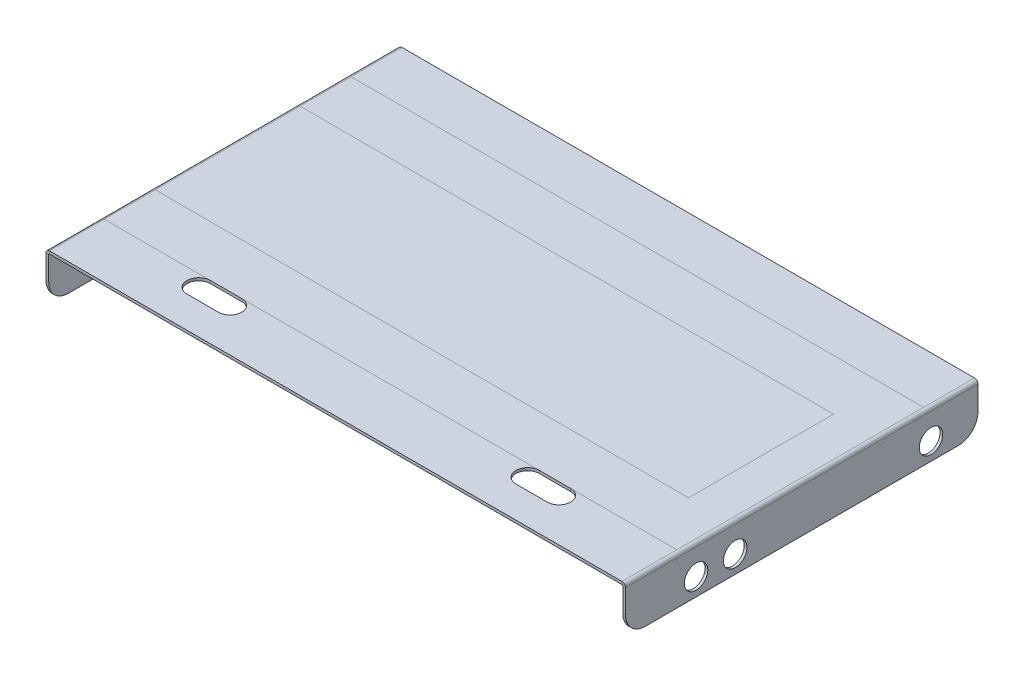
from build123d import *

# Parameters (mm, degrees)
SKETCH_1_W                         = 148
SKETCH_1_H                         = 90
SM_BASE_FLANGE_1_DEPTH             = 0.7
SM_EDGE_FLANGE_1_STRIP_W           = 3.2
SM_EDGE_FLANGE_1_STRIP_H           = 0.7
SM_EDGE_FLANGE_1_STRIP_CUT_DEPTH   = 90
SM_EDGE_FLANGE_1_STRIP_2_W         = 3.2
SM_EDGE_FLANGE_1_STRIP_2_H         = 0.7
SM_EDGE_FLANGE_1_STRIP_CUT_2_DEPTH = 90
SM_EDGE_FLANGE_1_DEPTH             = 90
SM_EDGE_FLANGE_1_PROFILE_W         = 90
SM_EDGE_FLANGE_1_PROFILE_H         = 11.1
SM_EDGE_FLANGE_1_PROFILE_R         = 3
SM_EDGE_FLANGE_1_FLAT_DEPTH        = 0.7
SM_EDGE_FLANGE_1_BEND_DEPTH        = 90
FILLET_2_R                         = 5
CUT_EXTRUDE_START                  = -10
SKETCH_15_R                        = 3
CUT_EXTRUDE_1_DEPTH                = 10
SPLIT_BODIES_1_SURFACE_1_BACK      = 174.632
SPLIT_BODIES_1_SURFACE_1_DEPTH     = 349.264
SPLIT_BODIES_1_SURFACE_2_BACK      = 174.632
SPLIT_BODIES_1_SURFACE_2_DEPTH     = 349.264


# Sheet-metal steps are written as plain solids
with BuildPart() as part:
    # Sketch 1 → 基体-法兰1 (new body)
    with BuildSketch(Plane(origin=(0, 0, 0), x_dir=(1, 0, 0), z_dir=(0, 1, 0))):
        Rectangle(SKETCH_1_W, SKETCH_1_H)
        with BuildLine():
            Line((-46, -31), (-38, -31))
            ThreePointArc((-38, -31), (-35, -34), (-38, -37))
            Line((-38, -37), (-46, -37))
            ThreePointArc((-46, -37), (-49, -34), (-46, -31))
        make_face(mode=Mode.SUBTRACT)
        with BuildLine():
            Line((38, -31), (46, -31))
            ThreePointArc((46, -31), (49, -34), (46, -37))
            Line((46, -37), (38, -37))
            ThreePointArc((38, -37), (35, -34), (38, -31))
        make_face(mode=Mode.SUBTRACT)
    extrude(amount=-SM_BASE_FLANGE_1_DEPTH)

    # 边线-法兰1 strip (across the edge) → 边线-法兰1 strip cut (cut)
    with BuildSketch(Plane(origin=(74, -0.7, -45), x_dir=(-1, 0, 0), z_dir=(0, 0, 1))):
        with Locations((-0.7, -0.35)):
            Rectangle(SM_EDGE_FLANGE_1_STRIP_W, SM_EDGE_FLANGE_1_STRIP_H)
    extrude(amount=SM_EDGE_FLANGE_1_STRIP_CUT_DEPTH, mode=Mode.SUBTRACT)

    # 边线-法兰1 strip 2 (across the edge) → 边线-法兰1 strip cut 2 (cut)
    with BuildSketch(Plane(origin=(-74, -0.7, 45), x_dir=(1, 0, 0), z_dir=(0, 0, -1))):
        with Locations((-0.7, -0.35)):
            Rectangle(SM_EDGE_FLANGE_1_STRIP_2_W, SM_EDGE_FLANGE_1_STRIP_2_H)
    extrude(amount=SM_EDGE_FLANGE_1_STRIP_CUT_2_DEPTH, mode=Mode.SUBTRACT)

    # 边线-法兰1 bend section (across the edge) → 边线-法兰1 (add)
    with BuildSketch(Plane(origin=(74, -0.7, -45), x_dir=(-1, 0, 0), z_dir=(0, 0, 1))):
        with BuildLine():
            Line((0, 0.2), (0.7, 0.2))
            ThreePointArc((0.7, 0.2), (0.758578644, 0.058578644), (0.9, 0))
            Line((0.9, 0), (0.9, -0.7))
            ThreePointArc((0.9, -0.7), (0.263603897, -0.436396103), (0, 0.2))
        make_face()
    extrude(amount=SM_EDGE_FLANGE_1_DEPTH)

    # 边线-法兰1 profile (on flange) → 边线-法兰1 flat (add)
    with BuildSketch(Plane(origin=(74, -0.7, 0), x_dir=(0, 0, 1), z_dir=(1, 0, 0))):
        with Locations((0, 5.75)):
            Rectangle(SM_EDGE_FLANGE_1_PROFILE_W, SM_EDGE_FLANGE_1_PROFILE_H)
        with Locations((17, 6.8)):
            Circle(SM_EDGE_FLANGE_1_PROFILE_R, mode=Mode.SUBTRACT)
        with Locations((27, 6.8)):
            Circle(SM_EDGE_FLANGE_1_PROFILE_R, mode=Mode.SUBTRACT)
        with Locations((-33, 6.8)):
            Circle(SM_EDGE_FLANGE_1_PROFILE_R, mode=Mode.SUBTRACT)
    extrude(amount=-SM_EDGE_FLANGE_1_FLAT_DEPTH)

    # 边线-法兰1 section (across the edge) → 边线-法兰1 bend (add)
    with BuildSketch(Plane(origin=(-74, -0.7, 45), x_dir=(1, 0, 0), z_dir=(0, 0, -1))):
        with BuildLine():
            Line((0, 0.2), (0, 11.3))
            Line((0, 11.3), (0.7, 11.3))
            Line((0.7, 11.3), (0.7, 0.2))
            ThreePointArc((0.7, 0.2), (0.758578644, 0.058578644), (0.9, 0))
            Line((0.9, 0), (0.9, -0.7))
            ThreePointArc((0.9, -0.7), (0.263603897, -0.436396103), (0, 0.2))
        make_face()
    extrude(amount=SM_EDGE_FLANGE_1_BEND_DEPTH)

    # 圆角2
    fillet_2_edges = [part.edges().sort_by_distance(p)[0] for p in [
        (-73.65, -12, 45),
        (-73.65, -12, -45),
        (73.65, -12, -45),
        (73.65, -12, 45),
    ]]
    fillet(fillet_2_edges, radius=FILLET_2_R)

    # 草图15 → 切除-拉伸1 (cut)
    with BuildSketch(Plane.ZY.offset(74).offset(CUT_EXTRUDE_START)):
        with Locations(Location((-33, -7.5, 0), (0, 0, 270))):
            Circle(SKETCH_15_R)
        with Locations(Location((17, -7.5, 0), (0, 0, 270))):
            Circle(SKETCH_15_R)
        with Locations(Location((27, -7.5, 0), (0, 0, 270))):
            Circle(SKETCH_15_R)
    extrude(amount=CUT_EXTRUDE_1_DEPTH, mode=Mode.SUBTRACT)


with BuildPart() as body_2:
    # Split Bodies 1: the piece behind the surface
    add(part.part)
    # Split Bodies 1 surface: a surface, the sketch's curves swept straight by 349.264 mm
    with BuildLine(Plane(origin=(0, 0, 0), x_dir=(1, 0, 0), z_dir=(0, 1, 0)).offset(-SPLIT_BODIES_1_SURFACE_1_BACK), mode=Mode.PRIVATE) as split_bodies_1_surface_1_path:
        Line((-73.1, 32), (73.1, 32))
        Line((73.1, 32), (73.1, -31))
        Line((73.1, -31), (-73.1, -31))
        Line((-73.1, -31), (-73.1, -18))
        Line((-73.1, -18), (63.1, -18))
        Line((63.1, -18), (63.1, 19))
        Line((63.1, 19), (-73.1, 19))
        Line((-73.1, 19), (-73.1, 32))
    split_bodies_1_surface_1 = Shell.extrude(split_bodies_1_surface_1_path.wire(), (0 * SPLIT_BODIES_1_SURFACE_1_DEPTH, 1 * SPLIT_BODIES_1_SURFACE_1_DEPTH, 0 * SPLIT_BODIES_1_SURFACE_1_DEPTH))
    split(bisect_by=split_bodies_1_surface_1, keep=Keep.BOTTOM)


with BuildPart() as part_1:
    add(part.part)

    # Split Bodies 1: split by a surface, the side it looks to stays
    # Split Bodies 1 surface: a surface, the sketch's curves swept straight by 349.264 mm
    with BuildLine(Plane(origin=(0, 0, 0), x_dir=(1, 0, 0), z_dir=(0, 1, 0)).offset(-SPLIT_BODIES_1_SURFACE_2_BACK), mode=Mode.PRIVATE) as split_bodies_1_surface_2_path:
        Line((-73.1, 32), (73.1, 32))
        Line((73.1, 32), (73.1, -31))
        Line((73.1, -31), (-73.1, -31))
        Line((-73.1, -31), (-73.1, -18))
        Line((-73.1, -18), (63.1, -18))
        Line((63.1, -18), (63.1, 19))
        Line((63.1, 19), (-73.1, 19))
        Line((-73.1, 19), (-73.1, 32))
    split_bodies_1_surface_2 = Shell.extrude(split_bodies_1_surface_2_path.wire(), (0 * SPLIT_BODIES_1_SURFACE_2_DEPTH, 1 * SPLIT_BODIES_1_SURFACE_2_DEPTH, 0 * SPLIT_BODIES_1_SURFACE_2_DEPTH))
    split(bisect_by=split_bodies_1_surface_2, keep=Keep.TOP)


solid = Compound([body_2.part, part_1.part])
